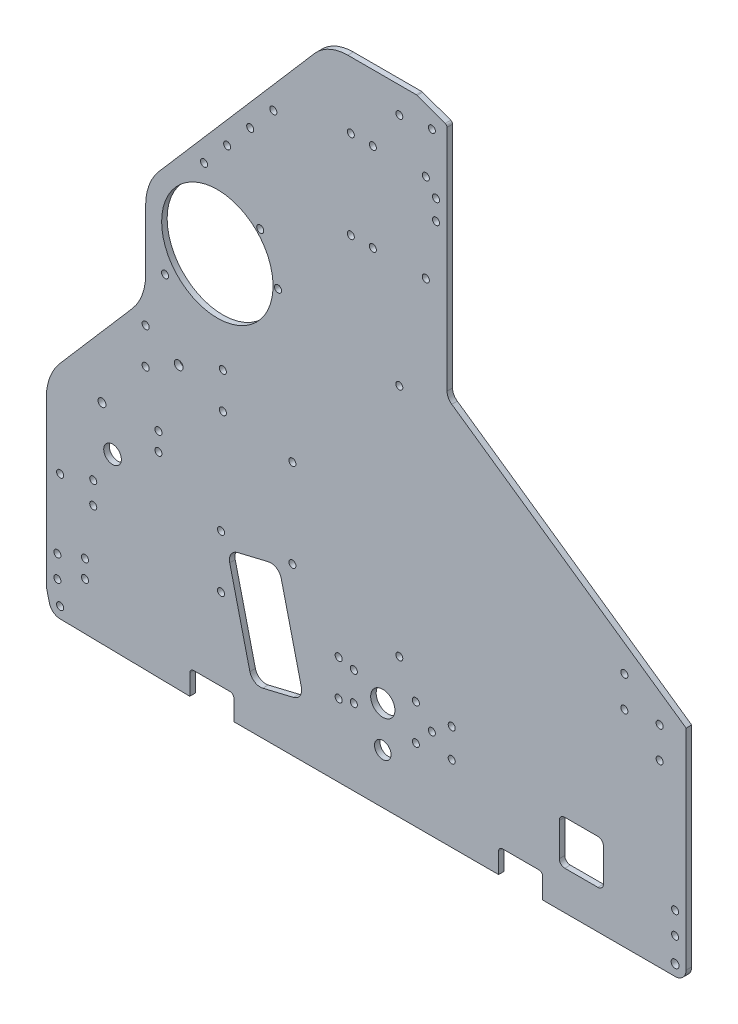
from build123d import *

# Parameters (mm, degrees)
SKETCH1_R           = 2.032
SKETCH1_R_2         = 5.08
SKETCH1_R_3         = 2.54
SKETCH1_R_4         = 2
BOSS_EXTRUDE1_DEPTH = 3.175
FILLET1_R           = 2.286
FILLET2_R           = 6.35
SKETCH2_R           = 2.032
CUT_EXTRUDE1_DEPTH  = 505.524983177
FILLET3_R           = 1.5875
SKETCH3_R           = 2.032
SKETCH3_R_2         = 2.286
CUT_EXTRUDE2_DEPTH  = 505.524983177
SKETCH4_R           = 2.032
SKETCH4_R_2         = 6.985
SKETCH4_R_3         = 4.7625
CUT_EXTRUDE3_DEPTH  = 505.524983177
SKETCH5_R           = 32.0675
SKETCH5_R_2         = 2.286000001
CUT_EXTRUDE5_DEPTH  = 505.524983177
FILLET4_R           = 31.75
CUT_EXTRUDE6_DEPTH  = 505.524983177
FILLET5_R           = 25.4
SKETCH8_R           = 2.031999999
SKETCH8_R_2         = 2.032
CUT_EXTRUDE7_DEPTH  = 505.524983177
SKETCH10_R          = 2.031999999
CUT_EXTRUDE8_DEPTH  = 505.524983177
FILLET6_R           = 6.35


with BuildPart() as part:
    # Sketch1 → Boss-Extrude1 (new body)
    with BuildSketch(Plane.XY):
        with BuildLine():
            Line((7.829508682, -19.049081656), (82.55, -20.32))
            Line((82.55, -20.32), (82.55, -6.35))
            Line((82.55, -6.35), (107.95, -6.35))
            Line((107.95, -6.35), (107.95, -20.32))
            Line((107.95, -20.32), (260.35, -20.32))
            Line((260.35, -20.32), (260.35, -6.35))
            Line((260.35, -6.35), (285.75, -6.35))
            Line((285.75, -6.35), (285.75, -20.32))
            Line((285.75, -20.32), (368.3, -20.32))
            Line((368.3, -20.32), (368.3, 106.68))
            Line((368.3, 106.68), (230.66375, 202.565))
            Line((230.66375, 202.565), (230.66375, 338.455))
            Line((230.66375, 338.455), (213.19998, 344.805))
            Line((213.19998, 344.805), (203.2, 344.805))
            Line((203.2, 344.805), (161.925, 344.805))
            Line((161.925, 344.805), (52.720122664, 218.469945827))
            ThreePointArc((52.720122664, 218.469945827), (52.803835479, 218.142145922), (52.832, 217.805))
            ThreePointArc((52.832, 217.805), (52.095493096, 216.239521914), (50.419872403, 215.808871996))
            Line((50.419872403, 215.808871996), (0, 157.48))
            Line((0, 157.48), (0, 0))
            Line((0, 0), (0, -6.35))
            ThreePointArc((0, -6.35), (0.047577015, -7.125863724), (0.189595124, -7.890101219))
            Line((0.189595124, -7.890101219), (1.777095124, -14.240101219))
            ThreePointArc((1.777095124, -14.240101219), (3.987212552, -17.671692778), (7.829508682, -19.049081656))
        make_face()
        with Locations((7.9375, -12.7)):
            Circle(SKETCH1_R, mode=Mode.SUBTRACT)
        with Locations((6.35, 0)):
            Circle(SKETCH1_R, mode=Mode.SUBTRACT)
        with Locations((6.35, 12.7)):
            Circle(SKETCH1_R, mode=Mode.SUBTRACT)
        with Locations((38.1, 78.105)):
            Circle(SKETCH1_R_2, mode=Mode.SUBTRACT)
        with Locations((57.15, 131.28625)):
            Circle(SKETCH1_R, mode=Mode.SUBTRACT)
        with Locations((57.15, 151.92375)):
            Circle(SKETCH1_R, mode=Mode.SUBTRACT)
        with Locations((76.2, 141.605)):
            Circle(SKETCH1_R_3, mode=Mode.SUBTRACT)
        with Locations((101.6, 131.28625)):
            Circle(SKETCH1_R, mode=Mode.SUBTRACT)
        with Locations((101.6, 151.92375)):
            Circle(SKETCH1_R, mode=Mode.SUBTRACT)
        with Locations((203.2, 59.805)):
            Circle(SKETCH1_R_4, mode=Mode.SUBTRACT)
        with Locations((361.95, 0)):
            Circle(SKETCH1_R, mode=Mode.SUBTRACT)
        with Locations((361.95, 12.7)):
            Circle(SKETCH1_R, mode=Mode.SUBTRACT)
        with Locations((353.06, 82.955052336)):
            Circle(SKETCH1_R, mode=Mode.SUBTRACT)
        with Locations((332.74, 98.195052336)):
            Circle(SKETCH1_R, mode=Mode.SUBTRACT)
        with Locations((332.74, 115.975052336)):
            Circle(SKETCH1_R, mode=Mode.SUBTRACT)
        with Locations((353.06, 100.735052336)):
            Circle(SKETCH1_R, mode=Mode.SUBTRACT)
        with Locations((68.326, 182.923674932)):
            Circle(SKETCH1_R, mode=Mode.SUBTRACT)
        with Locations((76.2, 217.805)):
            Circle(SKETCH1_R, mode=Mode.SUBTRACT)
        with Locations((90.779500502, 249.682)):
            Circle(SKETCH1_R, mode=Mode.SUBTRACT)
        with Locations((104.067838673, 265.054783374)):
            Circle(SKETCH1_R, mode=Mode.SUBTRACT)
        with Locations((117.356176844, 280.427566748)):
            Circle(SKETCH1_R, mode=Mode.SUBTRACT)
        with Locations((130.644515014, 295.800350122)):
            Circle(SKETCH1_R, mode=Mode.SUBTRACT)
        with Locations((203.2, 194.805)):
            Circle(SKETCH1_R_4, mode=Mode.SUBTRACT)
        with Locations((224.31375, 287.401)):
            Circle(SKETCH1_R, mode=Mode.SUBTRACT)
        with Locations((224.31375, 298.831)):
            Circle(SKETCH1_R, mode=Mode.SUBTRACT)
        with Locations((203.2, 329.805)):
            Circle(SKETCH1_R_4, mode=Mode.SUBTRACT)
        with Locations((221.931865, 332.105)):
            Circle(SKETCH1_R_4, mode=Mode.SUBTRACT)
    extrude(amount=BOSS_EXTRUDE1_DEPTH)

    # Fillet1
    fillet1_edges = [part.edges().sort_by_distance(p)[0] for p in [
        (285.75, -6.35, 1.5875),
        (107.95, -6.35, 1.5875),
        (260.35, -6.35, 1.5875),
        (82.55, -6.35, 1.5875),
    ]]
    fillet(fillet1_edges, radius=FILLET1_R)

    # Fillet2
    fillet2_edges = [part.edges().sort_by_distance(p)[0] for p in [
        (230.66375, 202.565, 1.5875),
    ]]
    fillet(fillet2_edges, radius=FILLET2_R)

    # Sketch2 → Cut-Extrude1 (cut, through all)
    with BuildSketch(Plane(origin=(0, 0, 0), x_dir=(-1, 0, 0), z_dir=(0, 0, -1))):
        with Locations((-100.552770272, 71.086035298)):
            Circle(SKETCH2_R)
        with Locations((-100.552770272, 40.606035298)):
            Circle(SKETCH2_R)
        with Locations((-22.225, 18.202541089)):
            Circle(SKETCH2_R)
        with Locations((-22.225, 8.042541089)):
            Circle(SKETCH2_R)
    extrude(amount=-CUT_EXTRUDE1_DEPTH, mode=Mode.SUBTRACT)

    # Fillet3
    fillet3_edges = [part.edges().sort_by_distance(p)[0] for p in [
        (230.66375, 338.455, 1.5875),
        (213.19998, 344.805, 1.5875),
    ]]
    fillet(fillet3_edges, radius=FILLET3_R)

    # Sketch3 → Cut-Extrude2 (cut, through all)
    with BuildSketch(Plane.XY.offset(3.175)):
        with BuildLine():
            Line((127.789350211, 69.359774106), (110.09075034, 65.117184968))
            ThreePointArc((110.09075034, 65.117184968), (106.287939856, 62.356288953), (105.55119507, 57.715047577))
            Line((105.55119507, 57.715047577), (117.160037875, 9.287010566))
            ThreePointArc((117.160037875, 9.287010566), (119.920933891, 5.484200083), (124.562175266, 4.747455297))
            Line((124.562175266, 4.747455297), (142.260775137, 8.990044434))
            ThreePointArc((142.260775137, 8.990044434), (146.063585621, 11.75094045), (146.800330407, 16.392181825))
            Line((146.800330407, 16.392181825), (135.191487602, 64.820218836))
            ThreePointArc((135.191487602, 64.820218836), (132.430591586, 68.62302932), (127.789350211, 69.359774106))
        make_face()
        with Locations((26.987500002, 46.953113935)):
            Circle(SKETCH3_R)
        with Locations((26.987500002, 59.653113935)):
            Circle(SKETCH3_R)
        with Locations((7.937500002, 53.303113935)):
            Circle(SKETCH3_R)
        with Locations((32.030600738, 100.810868776)):
            Circle(SKETCH3_R_2)
        with Locations((64.525942114, 102.94048958)):
            Circle(SKETCH3_R)
        with Locations((64.525942114, 92.525786339)):
            Circle(SKETCH3_R)
        with Locations((133.35, 208.228121768)):
            Circle(SKETCH3_R)
        with Locations((123.120704333, 232.923826101)):
            Circle(SKETCH3_R)
    extrude(amount=-CUT_EXTRUDE2_DEPTH, mode=Mode.SUBTRACT)

    # Sketch4 → Cut-Extrude3 (cut, through all)
    with BuildSketch(Plane.XY.offset(3.175)):
        with Locations((168.275, 42.06875)):
            Circle(SKETCH4_R)
        with Locations((212.725, 42.06875)):
            Circle(SKETCH4_R)
        with Locations((212.725, 21.43125)):
            Circle(SKETCH4_R)
        with Locations((168.275, 21.43125)):
            Circle(SKETCH4_R)
        with Locations((193.675, 31.75)):
            Circle(SKETCH4_R_2)
        with Locations((177.00498, 40.0431)):
            Circle(SKETCH4_R)
        with Locations((177.00498, 23.4569)):
            Circle(SKETCH4_R)
        with Locations((193.675, 8.466666658)):
            Circle(SKETCH4_R_3)
        with Locations((221.931865, 31.75)):
            Circle(SKETCH4_R)
        with Locations((233.36123, 23.4569)):
            Circle(SKETCH4_R)
        with Locations((233.36123, 40.0431)):
            Circle(SKETCH4_R)
    extrude(amount=-CUT_EXTRUDE3_DEPTH, mode=Mode.SUBTRACT)

    # Sketch5 → Cut-Extrude5 (cut, through all)
    with BuildSketch(Plane(origin=(0, 0, 0), x_dir=(-1, 0, 0), z_dir=(0, 0, -1))):
        Polygon((0, 157.48), (-57.15, 223.594705882), (-57.15, 165.333696112), (0, 99.218990229), align=None)
        with Locations((-98.425, 208.228121768)):
            Circle(SKETCH5_R)
        with Locations((-361.95, -13.97)):
            Circle(SKETCH5_R_2)
    extrude(amount=-CUT_EXTRUDE5_DEPTH, mode=Mode.SUBTRACT)

    # Fillet4
    fillet4_edges = [part.edges().sort_by_distance(p)[0] for p in [
        (0, 99.218990229, 1.5875),
        (57.15, 165.333696112, 1.5875),
        (57.15, 223.594705882, 1.5875),
    ]]
    fillet(fillet4_edges, radius=FILLET4_R)

    # Sketch6 → Cut-Extrude6 (cut, through all)
    with BuildSketch(Plane.XY.offset(3.175)):
        with BuildLine():
            Line((298.45, 27.305), (317.5, 27.305))
            ThreePointArc((317.5, 27.305), (319.74506403, 26.37506403), (320.675, 24.13))
            Line((320.675, 24.13), (320.675, 5.08))
            ThreePointArc((320.675, 5.08), (319.74506403, 2.83493597), (317.5, 1.905))
            Line((317.5, 1.905), (298.45, 1.905))
            ThreePointArc((298.45, 1.905), (296.20493597, 2.83493597), (295.275, 5.08))
            Line((295.275, 5.08), (295.275, 24.13))
            ThreePointArc((295.275, 24.13), (296.20493597, 26.37506403), (298.45, 27.305))
        make_face()
    extrude(amount=-CUT_EXTRUDE6_DEPTH, mode=Mode.SUBTRACT)

    # Fillet5
    fillet5_edges = [part.edges().sort_by_distance(p)[0] for p in [
        (161.925, 344.805, 1.5875),
    ]]
    fillet(fillet5_edges, radius=FILLET5_R)

    # Sketch8 → Cut-Extrude7 (cut, through all)
    with BuildSketch(Plane(origin=(0, 0, 0), x_dir=(-1, 0, 0), z_dir=(0, 0, -1))):
        with Locations((-187.96, 306.70500001)):
            Circle(SKETCH8_R)
        with Locations((-175.26, 306.70500001)):
            Circle(SKETCH8_R_2)
        with Locations((-218.44, 306.704999997)):
            Circle(SKETCH8_R_2)
        with Locations((-218.44, 255.904999997)):
            Circle(SKETCH8_R_2)
        with Locations((-187.96, 255.90500001)):
            Circle(SKETCH8_R)
        with Locations((-175.26, 255.90500001)):
            Circle(SKETCH8_R_2)
    extrude(amount=-CUT_EXTRUDE7_DEPTH, mode=Mode.SUBTRACT)

    # Sketch10 → Cut-Extrude8 (cut, through all)
    with BuildSketch(Plane.XY.offset(3.175)):
        with Locations((141.642480002, 75.160621768)):
            Circle(SKETCH10_R)
        with Locations((141.642480002, 125.960621768)):
            Circle(SKETCH10_R)
    extrude(amount=-CUT_EXTRUDE8_DEPTH, mode=Mode.SUBTRACT)

    # Fillet6
    fillet6_edges = [part.edges().sort_by_distance(p)[0] for p in [
        (368.3, -20.32, 1.5875),
    ]]
    fillet(fillet6_edges, radius=FILLET6_R)


solid = part.part
